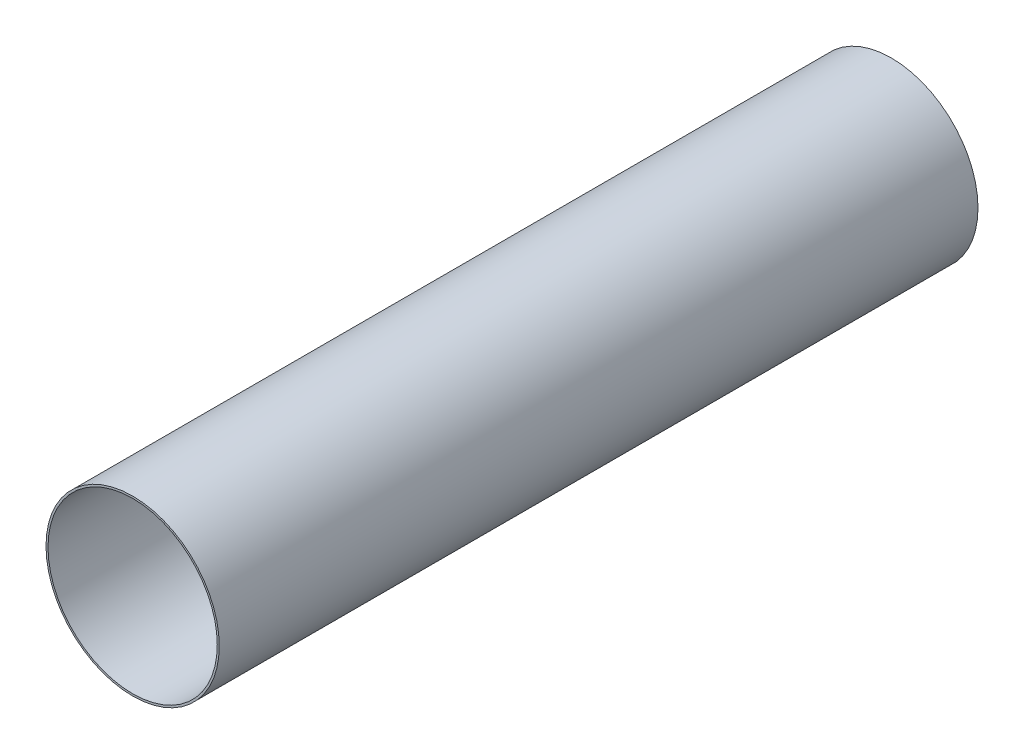
from build123d import *

# Parameters (mm, degrees)
SKETCH1_R           = 86.99983
SKETCH1_R_2         = 84.99983
BOSS_EXTRUDE1_DEPTH = 381


with BuildPart() as part:
    # Sketch1 → Boss-Extrude1 (new, symmetric)
    with BuildSketch(Plane.XY):
        Circle(SKETCH1_R)
        Circle(SKETCH1_R_2, mode=Mode.SUBTRACT)
    extrude(amount=BOSS_EXTRUDE1_DEPTH, both=True)


solid = part.part
